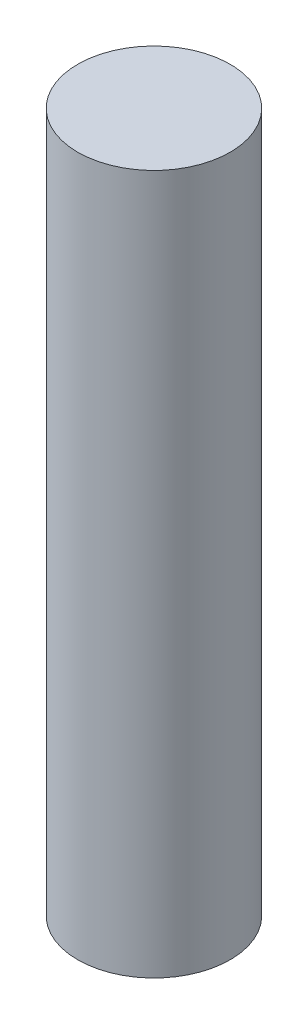
from build123d import *

# Parameters (mm, degrees)
SKETCH1_R           = 1
BOSS_EXTRUDE1_DEPTH = 9.175


with BuildPart() as part:
    # Sketch1 → Boss-Extrude1 (new body)
    with BuildSketch(Plane(origin=(0, 0, 0), x_dir=(1, 0, 0), z_dir=(0, 1, 0))):
        Circle(SKETCH1_R)
    extrude(amount=BOSS_EXTRUDE1_DEPTH)


solid = part.part
